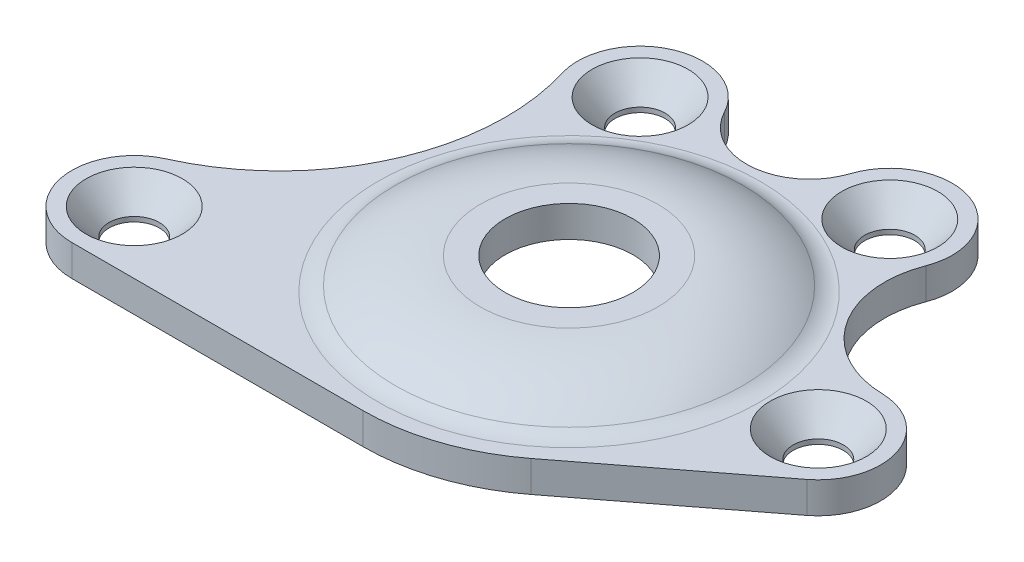
from build123d import *

# Parameters (mm, degrees)
SKETCH47_R                                   = 2.4892
SKETCH47_R_2                                 = 6.5
MOTOR_MOUNT_EXTRUDE_DEPTH                    = 6.35
CUT_EXTRUDE41_DEPTH                          = 108.595157342
SKETCH126_R                                  = 7.6
CUT_EXTRUDE67_DEPTH                          = 3.175
FILLET1_R                                    = 3.175
FILLET2_R                                    = 3.175
CSK_FOR_10_FLAT_HEAD_MACHINE_SCREW1_AT_COUNT = 2
CSK_FOR_10_FLAT_HEAD_MACHINE_SCREW1_AT_PITCH = 38.841839298
CSK_FOR_10_FLAT_HEAD_MACHINE_SCREW1_2_COUNT  = 2
CSK_FOR_10_FLAT_HEAD_MACHINE_SCREW1_2_PITCH  = 54.354911292
CSK_FOR_10_FLAT_HEAD_MACHINE_SCREW1_3_COUNT  = 2
CSK_FOR_10_FLAT_HEAD_MACHINE_SCREW1_3_PITCH  = 56.455277257


with BuildPart() as part:
    # Sketch47 → Motor Mount Extrude------- (new body)
    with BuildSketch(Plane(origin=(0, 25.4, 0), x_dir=(1, 0, 0), z_dir=(0, 1, 0))):
        with BuildLine():
            Line((-87.746629665, -52.146001055), (-71.655228587, -16.794122867))
            ThreePointArc((-71.655228587, -16.794122867), (-66.051255295, -13.07722651), (-60.250494121, -16.478844507))
            ThreePointArc((-60.250494121, -16.478844507), (-54.029624941, -19.900920012), (-48.455644094, -15.503130607))
            ThreePointArc((-48.455644094, -15.503130607), (-40.296945137, -11.501075174), (-36.491885667, -19.753489294))
            ThreePointArc((-36.491885667, -19.753489294), (-35.462620955, -28.838583686), (-27.445846957, -33.235134677))
            ThreePointArc((-27.445846957, -33.235134677), (-21.55821583, -37.612889318), (-23.72910556, -44.621182532))
            Line((-23.72910556, -44.621182532), (-39.596156498, -56.796398937))
            ThreePointArc((-39.596156498, -56.796398937), (-45.616988248, -60.014600555), (-52.352752243, -61.126679691))
            Line((-52.352752243, -61.126679691), (-81.967180737, -61.126679691))
            ThreePointArc((-81.967180737, -61.126679691), (-87.306998587, -58.213079745), (-87.746629665, -52.146001055))
        make_face()
        with Locations((-81.967180737, -54.776679691)):
            Circle(SKETCH47_R, mode=Mode.SUBTRACT)
        with Locations((-65.875779659, -19.424801504)):
            Circle(SKETCH47_R, mode=Mode.SUBTRACT)
        with Locations((-42.422737009, -17.484678513)):
            Circle(SKETCH47_R, mode=Mode.SUBTRACT)
        with Locations((-27.594740634, -39.583388821)):
            Circle(SKETCH47_R, mode=Mode.SUBTRACT)
        with Locations((-52.352752243, -40.171679691)):
            Circle(SKETCH47_R_2, mode=Mode.SUBTRACT)
    extrude(amount=MOTOR_MOUNT_EXTRUDE_DEPTH)

    # Sketch85 → Cut-Extrude41 (cut, through all)
    with BuildSketch(Plane(origin=(0, 31.75, 0), x_dir=(1, 0, 0), z_dir=(0, 1, 0))):
        with BuildLine():
            Line((-71.655228587, -16.794122867), (-87.746629665, -52.146001055))
            ThreePointArc((-87.746629665, -52.146001055), (-86.44125271, -50.270552754), (-84.556533191, -48.978597778))
            ThreePointArc((-84.556533191, -48.978597778), (-73.010983357, -37.515178828), (-71.948733766, -21.279991093))
            ThreePointArc((-71.948733766, -21.279991093), (-72.212231178, -19.010214796), (-71.655228587, -16.794122867))
        make_face()
    extrude(amount=-CUT_EXTRUDE41_DEPTH, mode=Mode.SUBTRACT)

    # Sketch126 → Cut-Extrude67 (cut)
    with BuildSketch(Plane.XZ.offset(-25.4)):
        with Locations((-52.352752243, 40.171679691)):
            Circle(SKETCH126_R)
    extrude(amount=-CUT_EXTRUDE67_DEPTH, mode=Mode.SUBTRACT)

    # Sketch127 → Cut-Revolve1 (revolve, cut)
    with BuildSketch(Plane(origin=(-52.352752243, 0, 0), x_dir=(0, 0, -1), z_dir=(1, 0, 0))):
        with BuildLine():
            Line((-31.131679691, 31.75), (10.628320309, 31.75))
            Line((10.628320309, 31.75), (10.628320309, 28.575))
            Line((10.628320309, 28.575), (-21.756679691, 28.575))
            ThreePointArc((-21.756679691, 28.575), (-26.182658323, 30.934708764), (-31.131679691, 31.75))
        make_face()
        Polygon((-32.571679691, 25.4), (-24.34227064, 25.4), (-28.741679691, 27.94), (-32.571679691, 27.94), align=None)
    revolve(axis=Axis((-52.352752243, 31.75, 40.171679691), (0, 1, 0)), mode=Mode.SUBTRACT)

    # Fillet1
    fillet1_edges = [part.edges().sort_by_distance(p)[0] for p in [
        (-52.352752243, 28.575, 58.586679691),
    ]]
    fillet(fillet1_edges, radius=FILLET1_R)

    # Fillet2
    fillet2_edges = [part.edges().sort_by_distance(p)[0] for p in [
        (-52.352752243, 25.4, 56.001088742),
        (-52.352752243, 27.94, 51.601679691),
    ]]
    fillet(fillet2_edges, radius=FILLET2_R)

    # Sketch131 → CSK for #10 Flat Head Machine Screw1 (revolve, cut)
    with BuildSketch(Plane(origin=(-81.967180737, 28.575, 54.776679691), x_dir=(0, 0, 1), z_dir=(1, 0, 0))):
        Polygon((0, 0), (0, 3.175), (2.5527, 3.175), (2.5527, 2.688180894), (4.8895, 0), align=None)
    csk_for_10_flat_head_machine_screw1 = revolve(axis=Axis((-81.967180737, 34.925, 54.776679691), (0, -1, 0)), mode=Mode.SUBTRACT)

    # CSK for #10 Flat Head Machine Screw1 at: CSK for #10 Flat Head Machine Screw1 ×2
    with Locations(*[Vector(0.4142801002487845, 0, -0.9101494374759879) * (i * CSK_FOR_10_FLAT_HEAD_MACHINE_SCREW1_AT_PITCH) for i in range(1, CSK_FOR_10_FLAT_HEAD_MACHINE_SCREW1_AT_COUNT)]):
        add(csk_for_10_flat_head_machine_screw1, mode=Mode.SUBTRACT)

    # CSK for _10 Flat Head Machine Screw1 2: CSK for #10 Flat Head Machine Screw1 ×2
    with Locations(*[Vector(0.7275229190417293, 0, -0.6860833785109515) * (i * CSK_FOR_10_FLAT_HEAD_MACHINE_SCREW1_2_PITCH) for i in range(1, CSK_FOR_10_FLAT_HEAD_MACHINE_SCREW1_2_COUNT)]):
        add(csk_for_10_flat_head_machine_screw1, mode=Mode.SUBTRACT)

    # CSK for _10 Flat Head Machine Screw1 3: CSK for #10 Flat Head Machine Screw1 ×2
    with Locations(*[Vector(0.9631064223643279, 0, -0.2691208263969642) * (i * CSK_FOR_10_FLAT_HEAD_MACHINE_SCREW1_3_PITCH) for i in range(1, CSK_FOR_10_FLAT_HEAD_MACHINE_SCREW1_3_COUNT)]):
        add(csk_for_10_flat_head_machine_screw1, mode=Mode.SUBTRACT)


solid = part.part
